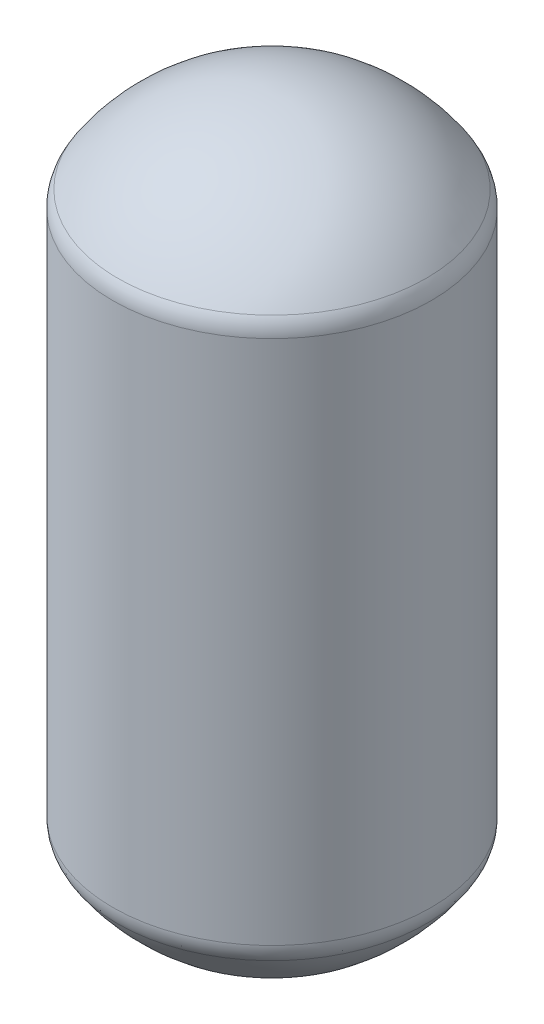
from build123d import *

# Parameters (mm, degrees)
FILLET1_R = 25.4


with BuildPart() as part:
    # Sketch1 → Revolve1 (revolve)
    with BuildSketch(Plane.XY):
        with BuildLine():
            Line((0, 605.725), (0, 608.9))
            ThreePointArc((0, 608.9), (-77.068833235, 588.517552605), (-133.985, 532.7))
            Line((-133.985, 532.7), (-133.985, 76.2))
            ThreePointArc((-133.985, 76.2), (-77.068833235, 20.382447395), (0, 0))
            Line((0, 0), (0, 3.175))
            ThreePointArc((0, 3.175), (-75.121348346, 22.928135015), (-130.81, 77.077718551))
            Line((-130.81, 77.077718551), (-130.81, 531.822281449))
            ThreePointArc((-130.81, 531.822281449), (-75.121348346, 585.971864985), (0, 605.725))
        make_face()
    revolve(axis=Axis((0, 0, 0), (0, 1, 0)))

    # Fillet1
    fillet1_edges = [part.edges().sort_by_distance(p)[0] for p in [
        (130.81, 77.077718551, 0),
        (133.985, 76.2, 0),
        (130.81, 531.822281449, 0),
        (133.985, 532.7, 0),
    ]]
    fillet(fillet1_edges, radius=FILLET1_R)


solid = part.part
